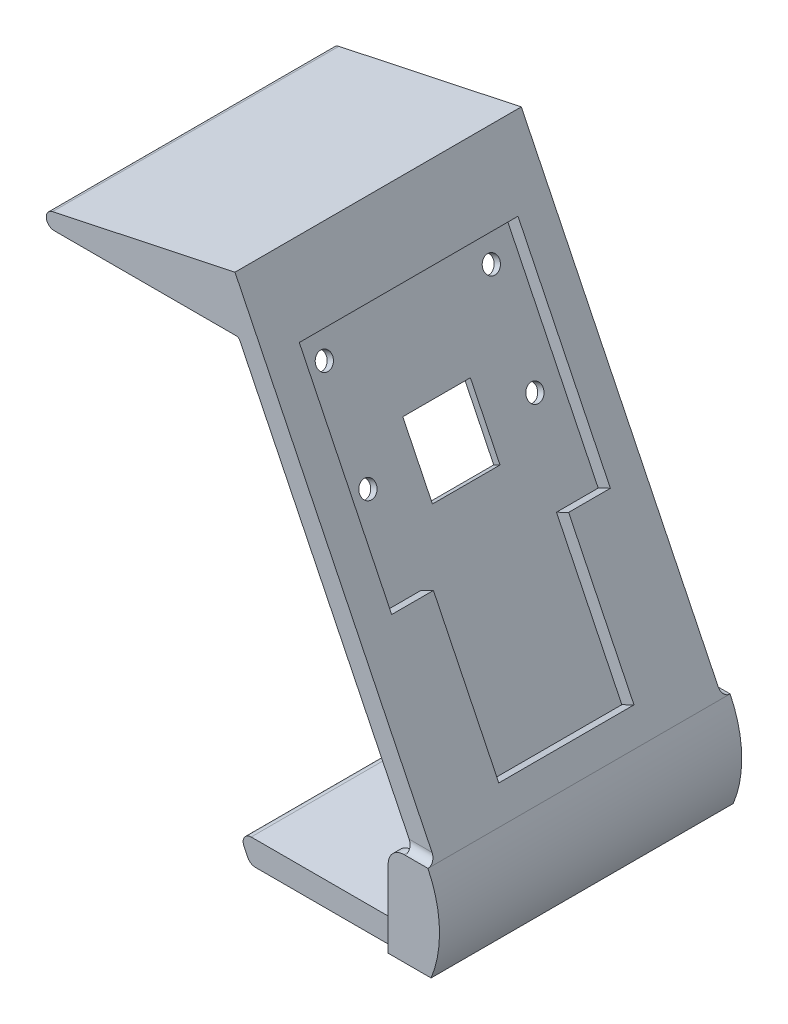
from build123d import *

# Parameters (mm, degrees)
BOSS_EXTRUDE1_DEPTH = 36
SKETCH4_R           = 1.05
SKETCH4_W           = 8.5
SKETCH4_H           = 8.5
CUT_EXTRUDE1_DEPTH  = 86.201472175
SKETCH4_3_W         = 27.5
SKETCH4_3_H         = 26.5
SKETCH4_3_W_2       = 25
SKETCH4_3_H_2       = 24
SKETCH4_3_R         = 1.05
SKETCH4_3_W_3       = 8.5
SKETCH4_3_H_3       = 8.5
CUT_EXTRUDE2_DEPTH  = 1.7
SKETCH5_W           = 17
SKETCH5_H           = 20
CUT_EXTRUDE3_DEPTH  = 1.7
FILLET1_R           = 0.5
BOSS_EXTRUDE2_DEPTH = 1
FILLET2_R           = 1
FILLET3_R           = 1


with BuildPart() as part:
    # Sketch2 → Boss-Extrude1 (new body)
    with BuildSketch(Plane.XY):
        with BuildLine():
            Line((0, 0), (-25.184422383, 51.63571796))
            Line((-25.184422383, 51.63571796), (-48.384422383, 51.63571796))
            ThreePointArc((-48.384422383, 51.63571796), (-49.378944278, 52.531189497), (-48.592334074, 53.613865561))
            Line((-48.592334074, 53.613865561), (-25.654772837, 58.48939471))
            Line((-25.654772837, 58.48939471), (-0.392745057, 6.694562109))
            ThreePointArc((-0.392745057, 6.694562109), (1.056036581, 0.865561175), (0, -5.047222168))
            Line((0, -5.047222168), (-23.13, -5.047222168))
            ThreePointArc((-23.13, -5.047222168), (-23.667026027, -4.875521503), (-24.040049398, -4.452754858))
            Line((-24.040049398, -4.452754858), (-24.527781987, -3.452754858))
            ThreePointArc((-24.527781987, -3.452754858), (-24.476528577, -2.474781543), (-23.62, -2))
            Line((-23.62, -2), (0, -2))
            Line((0, -2), (0, 0))
        make_face()
    extrude(amount=BOSS_EXTRUDE1_DEPTH)

    # Sketch4 → Cut-Extrude1 (cut, through all)
    with BuildSketch(Plane(origin=(2.320421937, 1.131745398, 0), x_dir=(0, 0, -1), z_dir=(0.898794046299168, 0.4383711467890754, 0))):
        with Locations(Location((-28.5, 51.816231926, 0), (0, 0, 90))):
            Circle(SKETCH4_R)
        with Locations(Location((-28.5, 39.316231926, 0), (0, 0, 90))):
            Circle(SKETCH4_R)
        with Locations(Location((-7.5, 51.816231926, 0), (0, 0, 90))):
            Circle(SKETCH4_R)
        with Locations(Location((-7.5, 39.316231926, 0), (0, 0, 90))):
            Circle(SKETCH4_R)
        with Locations((-18, 39.316231926)):
            Rectangle(SKETCH4_W, SKETCH4_H)
    extrude(amount=-CUT_EXTRUDE1_DEPTH, mode=Mode.SUBTRACT)

    # Sketch4<3> → Cut-Extrude2 (cut)
    # profile 1 of 2: a face of its own
    with BuildSketch(Plane(origin=(2.320421937, 1.131745398, 0), x_dir=(0, 0, -1), z_dir=(0.898794046299168, 0.4383711467890754, 0))):
        with Locations((-18, 41.816231926)):
            Rectangle(SKETCH4_3_W, SKETCH4_3_H)
        with Locations((-18, 41.816231926)):
            Rectangle(SKETCH4_3_W_2, SKETCH4_3_H_2, mode=Mode.SUBTRACT)
    # profile 2 of 2: a face of its own
    with BuildSketch(Plane(origin=(2.320421937, 1.131745398, 0), x_dir=(0, 0, -1), z_dir=(0.898794046299168, 0.4383711467890754, 0))):
        with Locations((-18, 41.816231926)):
            Rectangle(SKETCH4_3_W_2, SKETCH4_3_H_2)
        with Locations(Location((-7.5, 39.316231926, 0), (0, 0, 90))):
            Circle(SKETCH4_3_R, mode=Mode.SUBTRACT)
        with Locations(Location((-7.5, 51.816231926, 0), (0, 0, 90))):
            Circle(SKETCH4_3_R, mode=Mode.SUBTRACT)
        with Locations(Location((-28.5, 39.316231926, 0), (0, 0, 90))):
            Circle(SKETCH4_3_R, mode=Mode.SUBTRACT)
        with Locations(Location((-28.5, 51.816231926, 0), (0, 0, 90))):
            Circle(SKETCH4_3_R, mode=Mode.SUBTRACT)
        with Locations((-18, 39.316231926)):
            Rectangle(SKETCH4_3_W_3, SKETCH4_3_H_3, mode=Mode.SUBTRACT)
    extrude(amount=-CUT_EXTRUDE2_DEPTH, mode=Mode.SUBTRACT)

    # Sketch5 → Cut-Extrude3 (cut)
    with BuildSketch(Plane(origin=(2.320421937, 1.131745398, 0), x_dir=(0, 0, -1), z_dir=(0.898794046299168, 0.4383711467890754, 0))):
        with Locations((-18, 19.816231926)):
            Rectangle(SKETCH5_W, SKETCH5_H)
    extrude(amount=-CUT_EXTRUDE3_DEPTH, mode=Mode.SUBTRACT)

    # Fillet1
    fillet1_edges = [part.edges().sort_by_distance(p)[0] for p in [
        (0, 0, 18),
        (-25.184422383, 51.63571796, 18),
    ]]
    fillet(fillet1_edges, radius=FILLET1_R)

    # Sketch6 → Boss-Extrude2 (add)
    with BuildSketch(Plane.XY.offset(36)):
        with BuildLine():
            Line((-0.392745057, 6.694562109), (-3.392745057, 6.694562109))
            ThreePointArc((-3.392745057, 6.694562109), (-4.80695862, 6.108775671), (-5.392745057, 4.694562109))
            Line((-5.392745057, 4.694562109), (-5.392745057, -5.047222168))
            Line((-5.392745057, -5.047222168), (0, -5.047222168))
            ThreePointArc((0, -5.047222168), (1.056036581, 0.865561175), (-0.392745057, 6.694562109))
        make_face()
    boss_extrude2 = extrude(amount=BOSS_EXTRUDE2_DEPTH)

    # Fillet2
    # the kernel refuses this fillet: 1 mm, written as the material it adds along each edge
    with BuildSketch(Plane(origin=(-5.392745057, -2, 36), x_dir=(-1, 0, 0), z_dir=(0, -1, 0))) as fillet2_piece_1:
        with BuildLine():
            CenterArc((FILLET2_R, -FILLET2_R), FILLET2_R, 90, 90)
            Line((0, -FILLET2_R), (0, 0))
            Line((0, 0), (FILLET2_R, 0))
        make_face()
    extrude(amount=3.047222168)
    with BuildSketch(Plane(origin=(2.107254943, 6.694562109, 36), x_dir=(0, 0, 1), z_dir=(-1, 0, 0))) as fillet2_piece_2_section:
        with BuildLine():
            CenterArc((FILLET2_R, FILLET2_R), FILLET2_R, 180, 90)
            Line((0, FILLET2_R), (0, 0))
            Line((0, 0), (FILLET2_R, 0))
        make_face()
    fillet2_piece_2 = extrude(amount=7.872411049, mode=Mode.PRIVATE)
    fillet2_piece_2 = split(fillet2_piece_2, bisect_by=Plane(origin=(-0.632231225, 7.185581517, 36.086380113), z_dir=(-0.8987940462991679, -0.4383711467890754, 0)), keep=Keep.TOP, mode=Mode.PRIVATE)
    fillet2_piece_2 = split(fillet2_piece_2, bisect_by=Plane(origin=(-2.952653161, 6.053836119, 36.086380113), z_dir=(0.898794046299168, 0.43837114678907535, 0)), keep=Keep.TOP, mode=Mode.PRIVATE)
    add(fillet2_piece_2)

    # Mirror3: Boss-Extrude2 across plane
    add(boss_extrude2.mirror(Plane(origin=(0, 0, 18), x_dir=(1, 0, 0), z_dir=(0, 0, -1))))

    # Fillet3
    # the kernel refuses this fillet: 1 mm, written as the material it adds along each edge
    with BuildSketch(Plane(origin=(-5.392745057, -2, 0), x_dir=(-1, 0, 0), z_dir=(0, -1, 0))) as fillet3_piece_1:
        with BuildLine():
            CenterArc((FILLET3_R, FILLET3_R), FILLET3_R, 180, 90)
            Line((0, FILLET3_R), (0, 0))
            Line((0, 0), (FILLET3_R, 0))
        make_face()
    extrude(amount=3.047222168)
    with BuildSketch(Plane(origin=(2.107254943, 6.694562109, 0), x_dir=(0, 1, 0), z_dir=(-1, 0, 0))) as fillet3_piece_2_section:
        with BuildLine():
            CenterArc((FILLET3_R, FILLET3_R), FILLET3_R, 180, 90)
            Line((0, FILLET3_R), (0, 0))
            Line((0, 0), (FILLET3_R, 0))
        make_face()
    fillet3_piece_2 = extrude(amount=7.872411049, mode=Mode.PRIVATE)
    fillet3_piece_2 = split(fillet3_piece_2, bisect_by=Plane(origin=(-2.952649492, 6.053828597, -0.086392955), z_dir=(0.8987940462991654, 0.43837114678908073, 0)), keep=Keep.TOP, mode=Mode.PRIVATE)
    fillet3_piece_2 = split(fillet3_piece_2, bisect_by=Plane(origin=(-0.632227556, 7.185573995, -0.086392955), z_dir=(-0.8987940462991654, -0.43837114678908073, 0)), keep=Keep.TOP, mode=Mode.PRIVATE)
    add(fillet3_piece_2)


solid = part.part
